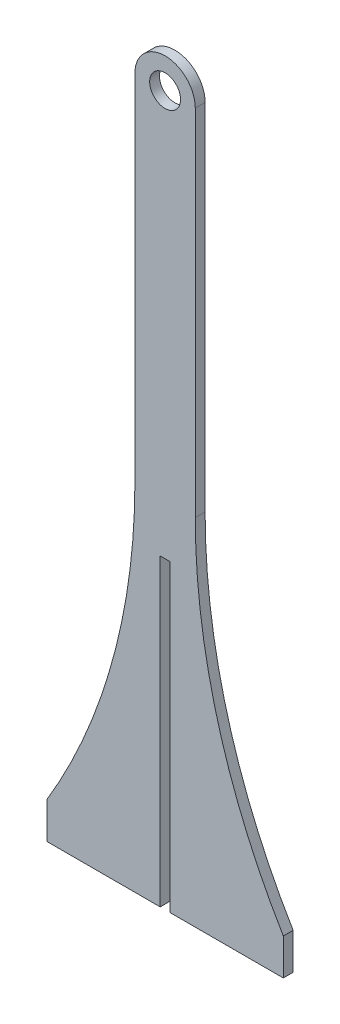
from build123d import *

# Parameters (mm, degrees)
SKETCH2_R           = 8.5
BOSS_EXTRUDE1_DEPTH = 5.4
CAVITY1_START       = -2.7
CAVITY1_OUTLINE_W   = 167.1
CAVITY1_OUTLINE_H   = 5.4
CAVITY1_DEPTH       = 5.4


# Read off the part's stored shape, not the designer's step: Cavity1
with BuildPart() as part:
    # Sketch2 → Boss-Extrude1 (new body)
    with BuildSketch(Plane.XY):
        with BuildLine():
            Line((-65, 0), (65, 0))
            Line((65, 0), (65, 20))
            ThreePointArc((65, 20), (28.922939589, 104.215144435), (16.6, 195))
            Line((16.6, 195), (16.6, 390))
            ThreePointArc((16.6, 390), (0, 406.6), (-16.6, 390))
            Line((-16.6, 390), (-16.6, 195))
            ThreePointArc((-16.6, 195), (-28.922939589, 104.215144435), (-65, 20))
            Line((-65, 20), (-65, 0))
        make_face()
        with Locations((0, 390)):
            Circle(SKETCH2_R, mode=Mode.SUBTRACT)
    extrude(amount=-BOSS_EXTRUDE1_DEPTH)

    # Cavity1 outline → Cavity1 (cut)
    with BuildSketch(Plane.YZ.offset(CAVITY1_START)):
        with Locations((83.55, -2.7)):
            Rectangle(CAVITY1_OUTLINE_W, CAVITY1_OUTLINE_H)
    extrude(amount=CAVITY1_DEPTH, mode=Mode.SUBTRACT)


solid = part.part
